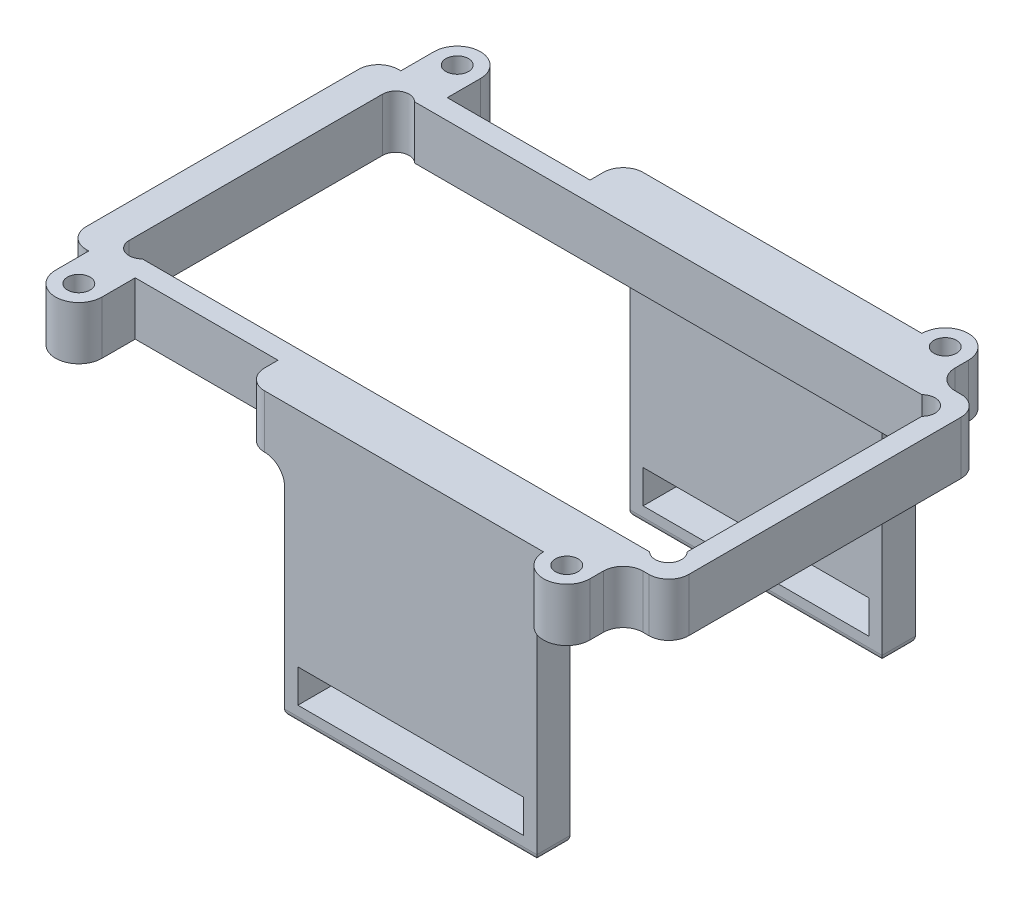
from build123d import *

# Parameters (mm, degrees)
EXTRUDE_1_DEPTH     = 23.5
EXTRUDE_START       = 8
SKETCH_2_R          = 1.7
EXTRUDE_2_DEPTH     = 8
CUT_EXTRUDE_1_REACH = 98.655
CUT_EXTRUDE_2_REACH = 79.127
CUT_EXTRUDE_3_REACH = 93.669
SKETCH_9_W          = 45
SKETCH_9_H          = 8
EXTRUDE_3_DEPTH     = 5
SKETCH_10_W         = 45
SKETCH_10_H         = 8
EXTRUDE_4_DEPTH     = 5
SKETCH_11_W         = 38
SKETCH_11_H         = 5
EXTRUDE_5_DEPTH     = 33
SKETCH_12_W         = 34
SKETCH_12_H         = 5
CUT_EXTRUDE_4_DEPTH = 5
CUT_EXTRUDE_START   = -23.5
CUT_EXTRUDE_5_DEPTH = 23.5
CUT_EXTRUDE_6_DEPTH = 67.550849919
FILLET_1_R          = 3
FILLET_2_R          = 1
FILLET_3_R          = 1


with BuildPart() as part:
    # 草图1 → 凸台-拉伸1 (new body)
    with BuildSketch(Plane(origin=(0, 0, 0), x_dir=(1, 0, 0), z_dir=(0, 1, 0))):
        with BuildLine():
            Line((-38, 23.5), (40, 23.5))
            Line((40, 23.5), (40, -23.5))
            Line((40, -23.5), (-38, -23.5))
            ThreePointArc((-38, -23.5), (-39.414213562, -22.914213562), (-40, -21.5))
            Line((-40, -21.5), (-40, 21.5))
            ThreePointArc((-40, 21.5), (-39.414213562, 22.914213562), (-38, 23.5))
        make_face()
        with BuildLine():
            Line((-34.171572875, -20.5), (36, -20.5))
            ThreePointArc((36, -20.5), (37.414213562, -19.914213562), (38, -18.5))
            Line((38, -18.5), (38, 18.5))
            ThreePointArc((38, 18.5), (37.414213562, 19.914213562), (36, 20.5))
            Line((36, 20.5), (-34.171572875, 20.5))
            ThreePointArc((-34.171572875, 20.5), (-37, 20.5), (-37, 17.671572875))
            Line((-37, 17.671572875), (-37, -17.671572875))
            ThreePointArc((-37, -17.671572875), (-37, -20.5), (-34.171572875, -20.5))
        make_face(mode=Mode.SUBTRACT)
    extrude(amount=EXTRUDE_1_DEPTH)

    # 草图2 → 凸台-拉伸2 (add)
    with BuildSketch(Plane.XZ.offset(EXTRUDE_START)):
        with BuildLine():
            Line((48.125, 23.5), (41.25, 23.5))
            Line((41.25, 23.5), (41.25, 28.5))
            ThreePointArc((41.25, 28.5), (37.75, 32), (34.25, 28.5))
            Line((34.25, 28.5), (34.25, 23.5))
            Line((34.25, 23.5), (-32.25, 23.5))
            Line((-32.25, 23.5), (-32.25, 28.5))
            ThreePointArc((-32.25, 28.5), (-35.75, 32), (-39.25, 28.5))
            Line((-39.25, 28.5), (-39.25, 23.5))
            Line((-39.25, 23.5), (-42.625, 23.5))
            Line((-42.625, 23.5), (-42.625, -23.5))
            Line((-42.625, -23.5), (-39.25, -23.5))
            Line((-39.25, -23.5), (-39.25, -28.5))
            ThreePointArc((-39.25, -28.5), (-35.75, -32), (-32.25, -28.5))
            Line((-32.25, -28.5), (-32.25, -23.5))
            Line((-32.25, -23.5), (34.25, -23.5))
            Line((34.25, -23.5), (34.25, -28.5))
            ThreePointArc((34.25, -28.5), (37.75, -32), (41.25, -28.5))
            Line((41.25, -28.5), (41.25, -23.5))
            Line((41.25, -23.5), (48.125, -23.5))
            Line((48.125, -23.5), (48.125, 23.5))
        make_face()
        with Locations(Location((37.75, 28.5, 0), (0, 0, 270))):
            Circle(SKETCH_2_R, mode=Mode.SUBTRACT)
        with Locations(Location((37.75, -28.5, 0), (0, 0, 90))):
            Circle(SKETCH_2_R, mode=Mode.SUBTRACT)
        with Locations(Location((-35.75, -28.5, 0), (0, 0, 270))):
            Circle(SKETCH_2_R, mode=Mode.SUBTRACT)
        with Locations(Location((-35.75, 28.5, 0), (0, 0, 90))):
            Circle(SKETCH_2_R, mode=Mode.SUBTRACT)
        with BuildLine():
            Line((-34.171572875, 20.5), (42.231907087, 20.5))
            ThreePointArc((42.231907087, 20.5), (45.060334211, 20.5), (45.060334211, 17.671572875))
            Line((45.060334211, 17.671572875), (45.060334211, -17.671572875))
            ThreePointArc((45.060334211, -17.671572875), (45.060334211, -20.5), (42.231907087, -20.5))
            Line((42.231907087, -20.5), (-34.171572875, -20.5))
            ThreePointArc((-34.171572875, -20.5), (-37, -20.5), (-37, -17.671572875))
            Line((-37, -17.671572875), (-37, 17.671572875))
            ThreePointArc((-37, 17.671572875), (-37, 20.5), (-34.171572875, 20.5))
        make_face(mode=Mode.SUBTRACT)
    extrude(amount=-EXTRUDE_2_DEPTH)

    # 草图4 → 切除-拉伸1 (cut, up to next)
    with BuildSketch(Plane.ZY.offset(40), mode=Mode.PRIVATE) as cut_extrude_1_sk1:
        with BuildLine():
            Line((17, 0), (-17, 0))
            ThreePointArc((-17, 0), (-19.121320344, 0.878679656), (-20, 3))
            Line((-20, 3), (-20, 17.5))
            ThreePointArc((-20, 17.5), (-19.121320344, 19.621320344), (-17, 20.5))
            Line((-17, 20.5), (17, 20.5))
            ThreePointArc((17, 20.5), (19.121320344, 19.621320344), (20, 17.5))
            Line((20, 17.5), (20, 3))
            ThreePointArc((20, 3), (19.121320344, 0.878679656), (17, 0))
        make_face()
    cut_extrude_1_tool1 = extrude(cut_extrude_1_sk1.sketch, amount=-CUT_EXTRUDE_1_REACH, mode=Mode.PRIVATE) & part.part
    add(cut_extrude_1_tool1.solids().sort_by_distance((-40, 10.25, 0))[0], mode=Mode.SUBTRACT)

    # 切除-拉伸2: up to this face of the body (flat: up to its plane)
    cut_extrude_2_end = Plane(part.part.faces().sort_by_distance((1, 8.207082452, 23.5))[0])
    # 草图5 → 切除-拉伸2 (cut, up to the picked face)
    with BuildSketch(Plane(origin=(0, 0, -23.5), x_dir=(-1, 0, 0), z_dir=(0, 0, -1)), mode=Mode.PRIVATE) as cut_extrude_2_sk1:
        with BuildLine():
            Line((-37, 11.75), (-37, 17.5))
            ThreePointArc((-37, 17.5), (-36.414213562, 18.914213562), (-35, 19.5))
            Line((-35, 19.5), (33, 19.5))
            ThreePointArc((33, 19.5), (34.414213562, 18.914213562), (35, 17.5))
            Line((35, 17.5), (35, 6))
            ThreePointArc((35, 6), (34.414213562, 4.585786438), (33, 4))
            Line((33, 4), (-35, 4))
            ThreePointArc((-35, 4), (-36.414213562, 4.585786438), (-37, 6))
            Line((-37, 6), (-37, 11.75))
        make_face()
    cut_extrude_2_tool1 = split(extrude(cut_extrude_2_sk1.sketch, amount=-CUT_EXTRUDE_2_REACH, mode=Mode.PRIVATE), bisect_by=cut_extrude_2_end, keep=Keep.BOTH, mode=Mode.PRIVATE)
    add(cut_extrude_2_tool1.solids().sort_by(Axis((1, 11.75, -23.5), (0, 0, 1)))[0], mode=Mode.SUBTRACT)

    # 草图6 → 切除-拉伸3 (cut, up to next)
    with BuildSketch(Plane(origin=(40, 0, 0), x_dir=(0, 0, -1), z_dir=(1, 0, 0)), mode=Mode.PRIVATE) as cut_extrude_3_sk1:
        with BuildLine():
            Line((21, 5), (21, 18.5))
            ThreePointArc((21, 18.5), (20.414213562, 19.914213562), (19, 20.5))
            Line((19, 20.5), (-19, 20.5))
            ThreePointArc((-19, 20.5), (-20.414213562, 19.914213562), (-21, 18.5))
            Line((-21, 18.5), (-21, 5))
            Line((-21, 5), (-21, 0))
            Line((-21, 0), (-16, 0))
            Line((-16, 0), (16, 0))
            Line((16, 0), (21, 0))
            Line((21, 0), (21, 5))
        make_face()
    cut_extrude_3_tool1 = extrude(cut_extrude_3_sk1.sketch, amount=-CUT_EXTRUDE_3_REACH, mode=Mode.PRIVATE) & part.part
    add(cut_extrude_3_tool1.solids().sort_by_distance((40, 10.230413, 0))[0], mode=Mode.SUBTRACT)

    # 草图9 → 凸台-拉伸3 (add)
    with BuildSketch(Plane.XY.offset(23.5)):
        with Locations((11.75, -4)):
            Rectangle(SKETCH_9_W, SKETCH_9_H)
    extrude(amount=EXTRUDE_3_DEPTH)

    # 草图10 → 凸台-拉伸4 (add)
    with BuildSketch(Plane(origin=(0, 0, -23.5), x_dir=(-1, 0, 0), z_dir=(0, 0, -1))):
        with Locations((-11.75, -4)):
            Rectangle(SKETCH_10_W, SKETCH_10_H)
    extrude(amount=EXTRUDE_4_DEPTH)

    # 草图11 → 凸台-拉伸5 (add)
    with BuildSketch(Plane.XZ.offset(8)):
        with Locations((14.25, 26)):
            Rectangle(SKETCH_11_W, SKETCH_11_H)
    extrude_5 = extrude(amount=EXTRUDE_5_DEPTH)

    # 草图12 → 切除-拉伸4 (cut)
    with BuildSketch(Plane(origin=(0, 0, 23.5), x_dir=(-1, 0, 0), z_dir=(0, 0, -1))):
        with Locations((-14.25, -36)):
            Rectangle(SKETCH_12_W, SKETCH_12_H)
    cut_extrude_4 = extrude(amount=-CUT_EXTRUDE_4_DEPTH, mode=Mode.SUBTRACT)

    # 镜向1: 凸台-拉伸5, 切除-拉伸4 across plane
    add(extrude_5.mirror(Plane.XY))
    add(cut_extrude_4.mirror(Plane.XY), mode=Mode.SUBTRACT)

    # 草图13 → 切除-拉伸5 (cut)
    with BuildSketch(Plane(origin=(0, 23.5, 0), x_dir=(1, 0, 0), z_dir=(0, 1, 0)).offset(CUT_EXTRUDE_START)):
        with BuildLine():
            Line((-38, 23.5), (40, 23.5))
            Line((40, 23.5), (40, -23.5))
            Line((40, -23.5), (-38, -23.5))
            ThreePointArc((-38, -23.5), (-39.414213562, -22.914213562), (-40, -21.5))
            Line((-40, -21.5), (-40, 21.5))
            ThreePointArc((-40, 21.5), (-39.414213562, 22.914213562), (-38, 23.5))
        make_face()
        with BuildLine():
            Line((38, 18.5), (38, -18.5))
            ThreePointArc((38, -18.5), (37.414213562, -19.914213562), (36, -20.5))
            Line((36, -20.5), (-34.171572875, -20.5))
            ThreePointArc((-34.171572875, -20.5), (-37, -20.5), (-37, -17.671572875))
            Line((-37, -17.671572875), (-37, 17.671572875))
            ThreePointArc((-37, 17.671572875), (-37, 20.5), (-34.171572875, 20.5))
            Line((-34.171572875, 20.5), (36, 20.5))
            ThreePointArc((36, 20.5), (37.414213562, 19.914213562), (38, 18.5))
        make_face(mode=Mode.SUBTRACT)
    extrude(amount=CUT_EXTRUDE_5_DEPTH, mode=Mode.SUBTRACT)

    # 草图14 → 切除-拉伸6 (cut, through all)
    with BuildSketch(Plane.XZ.offset(8)):
        with BuildLine():
            Line((-37.585786438, 19.085786438), (-37.585786438, -19.085786438))
            ThreePointArc((-37.585786438, -19.085786438), (-37.433545503, -18.320419573), (-37, -17.671572875))
            Line((-37, -17.671572875), (-37, 17.671572875))
            ThreePointArc((-37, 17.671572875), (-37.433545503, 18.320419573), (-37.585786438, 19.085786438))
        make_face()
    extrude(amount=-CUT_EXTRUDE_6_DEPTH, mode=Mode.SUBTRACT)

    # 圆角1
    fillet_1_edges = [part.edges().sort_by_distance(p)[0] for p in [
        (-10.75, -4, 28.5),
        (-10.75, -4, -28.5),
        (-42.625, -4, 23.5),
        (-42.625, -4, -23.5),
        (-4.75, -8, 26),
        (-4.75, -8, -26),
        (41.25, -4, 23.5),
        (41.25, -4, -23.5),
        (48.125, -4, 23.5),
        (48.125, -4, -23.5),
    ]]
    fillet(fillet_1_edges, radius=FILLET_1_R - 0.0001)  # a hair under: the kernel refuses the full size

    # 圆角2
    fillet_2_edges = [part.edges().sort_by_distance(p)[0] for p in [
        (33.25, -8, 26),
        (33.25, -8, -26),
    ]]
    fillet(fillet_2_edges, radius=FILLET_2_R)

    # 圆角3
    fillet_3_edges = [part.edges().sort_by_distance(p)[0] for p in [
        (-4.75, -41, 26),
        (14.25, -41, 23.5),
        (33.25, -41, 26),
        (14.25, -41, 28.5),
        (-4.75, -41, -26),
        (14.25, -41, -28.5),
        (33.25, -41, -26),
        (14.25, -41, -23.5),
    ]]
    fillet(fillet_3_edges, radius=FILLET_3_R)


solid = part.part
